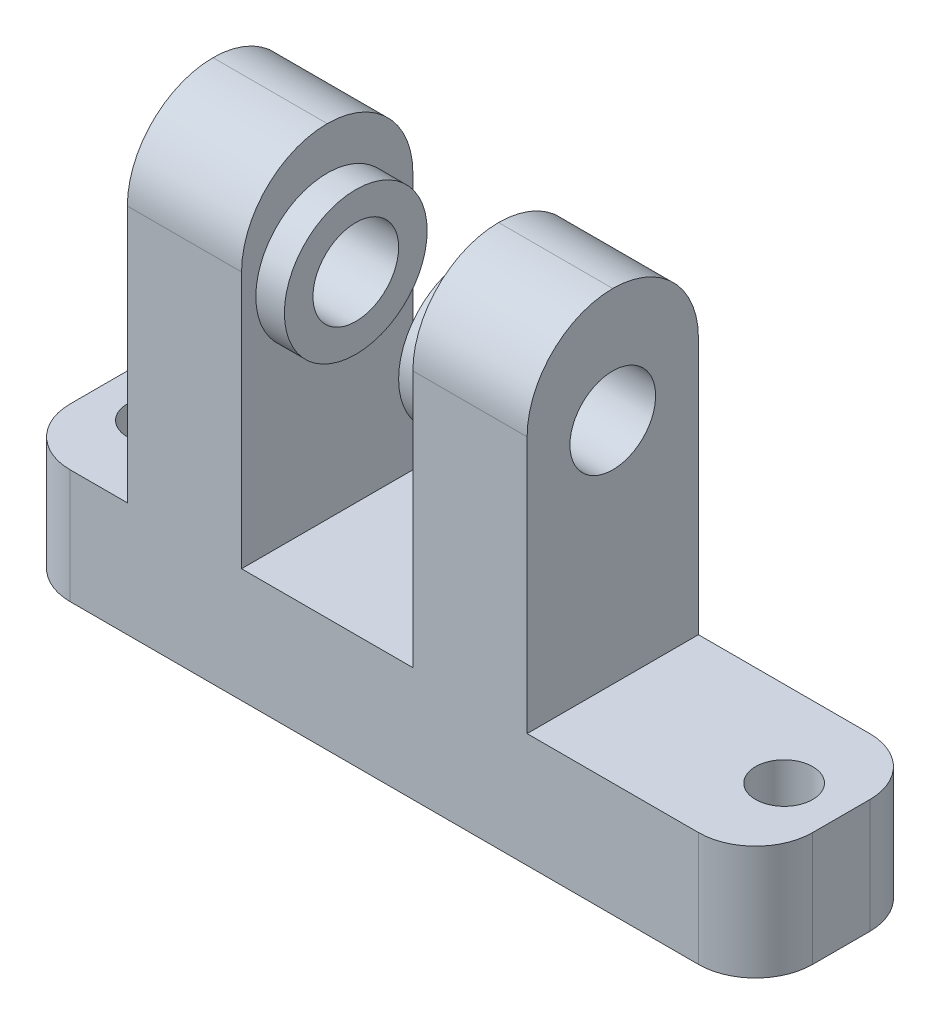
from build123d import *
from build123d.topology import SkipClean

# Parameters (mm, degrees)
SKETCH2_W               = 14
SKETCH2_H               = 6
BOSS_EXTRUDE1_DEPTH     = 4
SKETCH3_W               = 4
SKETCH3_H               = 6
BOSS_EXTRUDE2_DEPTH     = 12
CUT_EXTRUDE1_DEPTH      = 22.470910554
CUT_EXTRUDE1_DEPTH_BACK = 22.470910554
SKETCH4_R               = 1.5
BOSS_EXTRUDE3_START     = 1
SKETCH5_R               = 2.5
SKETCH5_R_2             = 1.5
BOSS_EXTRUDE3_DEPTH     = 1
SKETCH6_R               = 2.5
SKETCH6_R_2             = 1.5
BOSS_EXTRUDE4_DEPTH     = 1
SKETCH7_W               = 8
SKETCH7_H               = 6
SKETCH7_R               = 1
SKETCH7_W_2             = 4
BOSS_EXTRUDE5_DEPTH     = 4
FILLET1_R               = 2
FILLET2_R               = 3


with BuildPart() as part:
    # Sketch2 → Boss-Extrude1 (new body)
    with BuildSketch(Plane(origin=(0, 0, 0), x_dir=(1, 0, 0), z_dir=(0, 1, 0))):
        Rectangle(SKETCH2_W, SKETCH2_H)
    extrude(amount=BOSS_EXTRUDE1_DEPTH)

    # Sketch3 → Boss-Extrude2 (add)
    with BuildSketch(Plane(origin=(0, 4, 0), x_dir=(1, 0, 0), z_dir=(0, 1, 0))):
        with Locations((-5, 0)):
            Rectangle(SKETCH3_W, SKETCH3_H)
        with Locations((5, 0)):
            Rectangle(SKETCH3_W, SKETCH3_H)
    extrude(amount=BOSS_EXTRUDE2_DEPTH)

    # Sketch4 → Cut-Extrude1 (cut, two sides: drawn at the far end of the back side and taken through both)
    with BuildSketch(Plane(origin=(7, 0, 0), x_dir=(0, 0, -1), z_dir=(1, 0, 0)).offset(-CUT_EXTRUDE1_DEPTH_BACK)):
        with Locations((0, 12)):
            Circle(SKETCH4_R)
    extrude(amount=CUT_EXTRUDE1_DEPTH + CUT_EXTRUDE1_DEPTH_BACK, mode=Mode.SUBTRACT)

    # Sketch5 → Boss-Extrude3 (add)
    with BuildSketch(Plane(origin=(-3, 0, 0), x_dir=(0, 0, -1), z_dir=(1, 0, 0)).offset(BOSS_EXTRUDE3_START)):
        with Locations(Location((0, 12, 0), (0, 0, 180))):
            Circle(SKETCH5_R)
        with Locations((0, 12)):
            Circle(SKETCH5_R_2, mode=Mode.SUBTRACT)
    extrude(amount=-BOSS_EXTRUDE3_DEPTH)

    # Sketch6 → Boss-Extrude4 (add)
    with SkipClean():  # the faces are left unmerged after this step: merging them gives an invalid solid
        with BuildSketch(Plane.ZY.offset(-3)):
            with Locations((0, 12)):
                Circle(SKETCH6_R)
            with Locations((0, 12)):
                Circle(SKETCH6_R_2, mode=Mode.SUBTRACT)
        extrude(amount=BOSS_EXTRUDE4_DEPTH)

    # Sketch7 → Boss-Extrude5 (add)
    # profile 1 of 2: a face of its own
    with SkipClean():  # the faces are left unmerged after this step: merging them gives an invalid solid
        with BuildSketch(Plane(origin=(0, 4, 0), x_dir=(1, 0, 0), z_dir=(0, 1, 0))):
            with Locations((11, 0)):
                Rectangle(SKETCH7_W, SKETCH7_H)
            with Locations(Location((13, 0, 0), (0, 0, 270))):
                Circle(SKETCH7_R, mode=Mode.SUBTRACT)
        # profile 2 of 2: a face of its own
        with BuildSketch(Plane(origin=(0, 4, 0), x_dir=(1, 0, 0), z_dir=(0, 1, 0))):
            with Locations((-9, 0)):
                Rectangle(SKETCH7_W_2, SKETCH7_H)
            with Locations(Location((-9, 0, 0), (0, 0, 270))):
                Circle(SKETCH7_R, mode=Mode.SUBTRACT)
        extrude(amount=-BOSS_EXTRUDE5_DEPTH)

    # Fillet1
    fillet1_edges = [part.edges().sort_by_distance(p)[0] for p in [
        (15, 2, -3),
        (15, 2, 3),
        (-11, 2, 3),
        (-11, 2, -3),
    ]]
    fillet(fillet1_edges, radius=FILLET1_R)

    # Fillet2
    fillet2_edges = [part.edges().sort_by_distance(p)[0] for p in [
        (-5, 16, -3),
        (5, 16, -3),
        (5, 16, 3),
        (-5, 16, 3),
    ]]
    fillet(fillet2_edges, radius=FILLET2_R - 0.0001)  # a hair under: the kernel refuses the full size


solid = part.part
